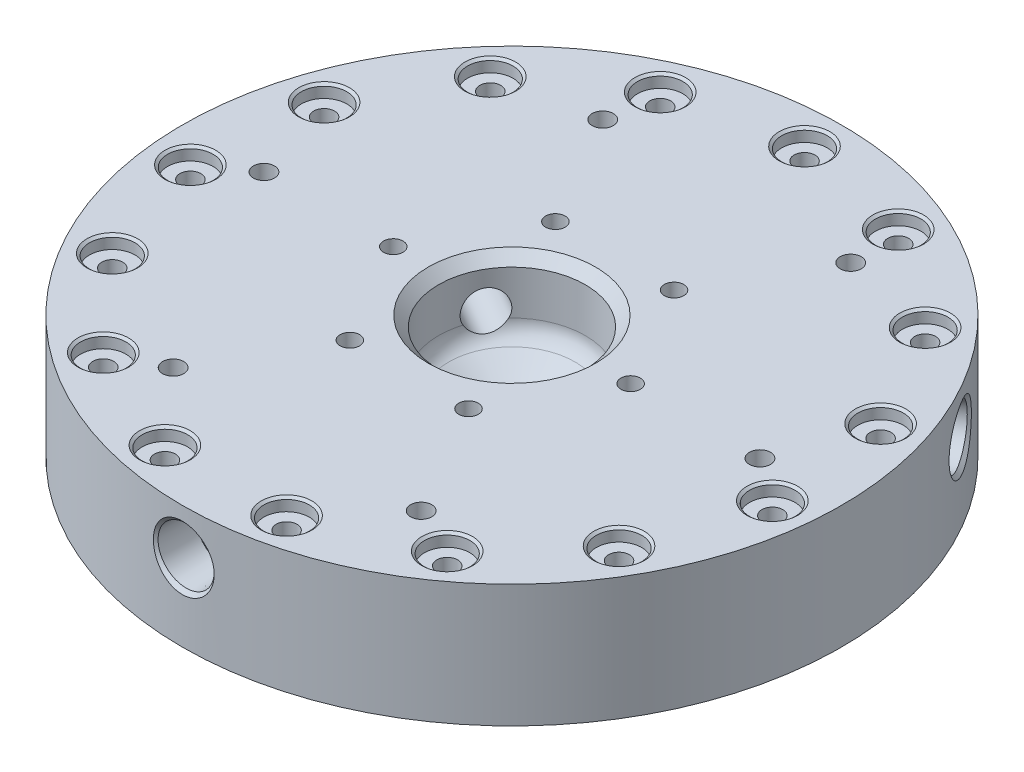
from build123d import *

# Parameters (mm, degrees)
SKETCH1_R           = 80.54
BOSS_EXTRUDE1_DEPTH = 30
CIRPATTERN1_COUNT   = 3
CIRPATTERN2_COUNT   = 15
CIRPATTERN3_COUNT   = 6
SKETCH21_W          = 5
SKETCH21_H          = 3
CHAMFER1_SIZE       = 2.5
CIRPATTERN4_COUNT   = 6


with BuildPart() as part:
    # Sketch1 → Boss-Extrude1 (new body)
    with BuildSketch(Plane(origin=(0, 0, 0), x_dir=(1, 0, 0), z_dir=(0, 1, 0))):
        Circle(SKETCH1_R)
    extrude(amount=BOSS_EXTRUDE1_DEPTH)

    # Sketch2 → Cut-Revolve1 (revolve, cut)
    with BuildSketch(Plane.XY):
        with BuildLine():
            Line((-6.06816, 0), (-6.06816, 4.113248654))
            ThreePointArc((-6.06816, 4.113248654), (-6.738032981, 6.613248654), (-8.56816, 8.443375673))
            Line((-8.56816, 8.443375673), (-15.4203, 12.399460546))
            ThreePointArc((-15.4203, 12.399460546), (-17.250427019, 14.229587565), (-17.9203, 16.729587565))
            Line((-17.9203, 16.729587565), (-17.9203, 30))
            Line((-17.9203, 30), (0, 30))
            Line((0, 30), (0, 0))
            Line((0, 0), (-6.06816, 0))
        make_face()
    revolve(axis=Axis((0, 30, 0), (0, -1, 0)), mode=Mode.SUBTRACT)

    # Sketch5 → 1/4 NPT Tapped Hole1 (revolve, cut)
    with BuildSketch(Plane(origin=(0, 18.904757199, 80.54), x_dir=(0, -1, 0), z_dir=(1, 0, 0))):
        Polygon((0, 0), (0, 83.321347754), (4.62894, 80.54), (4.62894, 10.02), (6.58554395, 10.02), (6.8579873, 0.9207627), (7.77875, 0), align=None)
    f_1_4_npt_tapped_hole1 = revolve(axis=Axis((0, 18.904757199, 86.89), (0, 0, -1)), mode=Mode.SUBTRACT)

    # CirPattern1: 1/4 NPT Tapped Hole1 ×3 about axis
    cirpattern1_axis = Axis((0, 30, 0), (0, -1, 0))
    for i in range(1, CIRPATTERN1_COUNT):
        add(f_1_4_npt_tapped_hole1.rotate(cirpattern1_axis, i * 360 / CIRPATTERN1_COUNT), mode=Mode.SUBTRACT)

    # Sketch7 → CBORE for #10 Binding Head Machine Screw1 (revolve, cut)
    with BuildSketch(Plane(origin=(0, 30, -71.5), x_dir=(0, 0, 1), z_dir=(1, 0, 0))):
        Polygon((0, 0), (0, 30), (2.5527, 30), (2.5527, 3.1242), (5.55625, 3.1242), (5.55625, 0.532828266), (6.19125, 0), align=None)
    cbore_for_10_binding_head_machine_screw = revolve(axis=Axis((0, 36.35, -71.5), (0, -1, 0)), mode=Mode.SUBTRACT)

    # CirPattern2: CBORE for #10 Binding Head Machine Screw1 ×15 about axis
    cirpattern2_axis = Axis((0, 30, 0), (0, -1, 0))
    for i in range(1, CIRPATTERN2_COUNT):
        add(cbore_for_10_binding_head_machine_screw.rotate(cirpattern2_axis, i * 360 / CIRPATTERN2_COUNT), mode=Mode.SUBTRACT)

    # Sketch19 → 13/64 (0.20313) Diameter Hole3 (revolve, cut)
    with BuildSketch(Plane(origin=(30.305, 30, -52.489799723), x_dir=(0, 0, 1), z_dir=(1, 0, 0))):
        Polygon((0, 0), (0, 14.250070783), (2.579751, 12.7), (2.579751, 0), align=None)
    f_13_64_0_20313_diameter_hole3 = revolve(axis=Axis((30.305, 36.35, -52.489799723), (0, -1, 0)), mode=Mode.SUBTRACT)

    # CirPattern3: 13/64 (0.20313) Diameter Hole3 ×6 about axis
    cirpattern3_axis = Axis((0, 30, 0), (0, -1, 0))
    for i in range(1, CIRPATTERN3_COUNT):
        add(f_13_64_0_20313_diameter_hole3.rotate(cirpattern3_axis, i * 360 / CIRPATTERN3_COUNT), mode=Mode.SUBTRACT)

    # Sketch21 → Cut-Revolve2 (revolve, cut)
    with BuildSketch(Plane.XY):
        with Locations((62.5, 1.5)):
            Rectangle(SKETCH21_W, SKETCH21_H)
    revolve(axis=Axis((0, 0, 0), (0, -1, 0)), mode=Mode.SUBTRACT)

    # Chamfer1
    chamfer1_edges = [part.edges().sort_by_distance(p)[0] for p in [
        (17.9203, 30, 0),
    ]]
    chamfer(chamfer1_edges, length=CHAMFER1_SIZE)

    # Sketch28 → 3/16 (0.1875) Diameter Hole1 (revolve, cut)
    with BuildSketch(Plane(origin=(29, 30, 0), x_dir=(0, 0, 1), z_dir=(1, 0, 0))):
        Polygon((0, 0), (0, 13.430799349), (2.38125, 12), (2.38125, 0), align=None)
    f_3_16_0_1875_diameter_hole1 = revolve(axis=Axis((29, 36.35, 0), (0, -1, 0)), mode=Mode.SUBTRACT)

    # CirPattern4: 3/16 (0.1875) Diameter Hole1 ×6 about axis
    cirpattern4_axis = Axis((0, 30, 0), (0, -1, 0))
    for i in range(1, CIRPATTERN4_COUNT):
        add(f_3_16_0_1875_diameter_hole1.rotate(cirpattern4_axis, i * 360 / CIRPATTERN4_COUNT), mode=Mode.SUBTRACT)


solid = part.part
